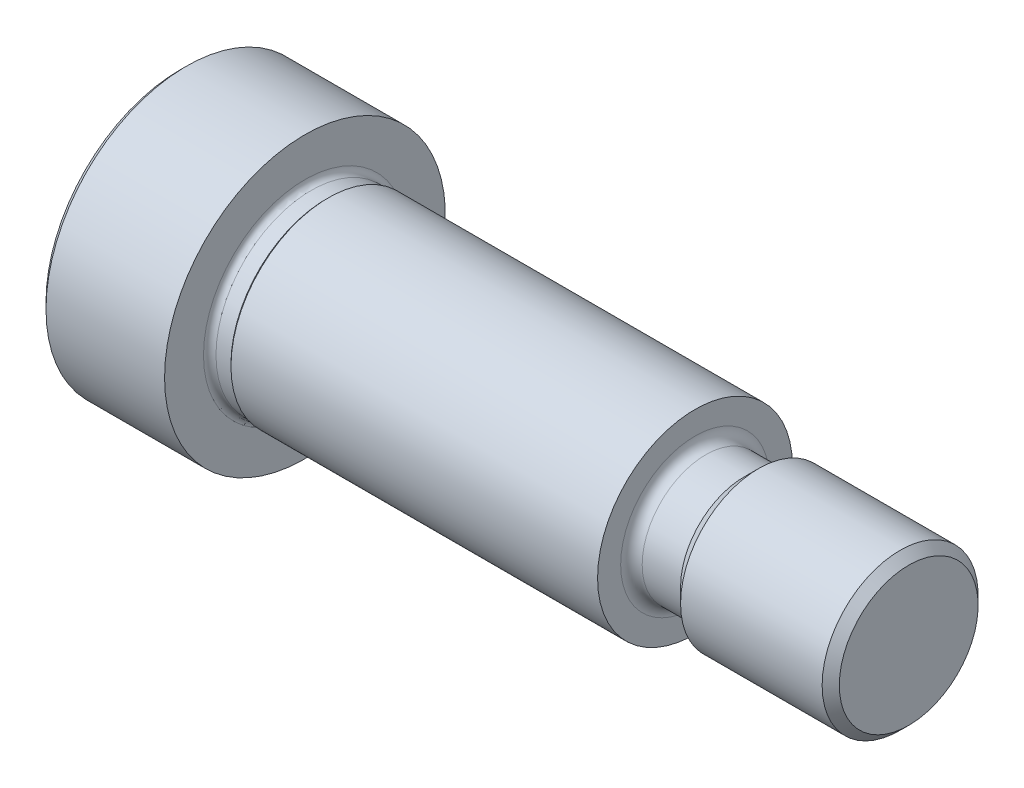
from build123d import *

# Parameters (mm, degrees)
CHAMFER1_SIZE = 0.8
HEX_2_DEPTH   = 10


with BuildPart() as part:
    # BodySke → BaseBody (revolve)
    with BuildSketch(Plane.XY):
        with BuildLine():
            Line((0, 0), (0, 18))
            Line((0, 18), (16, 18))
            Line((16, 18), (16, 13.01))
            ThreePointArc((16, 13.01), (16.234314575, 12.444314575), (16.8, 12.21))
            Line((16.8, 12.21), (18.72, 12.21))
            Line((18.72, 12.21), (19, 12.49))
            Line((19, 12.49), (66, 12.49))
            Line((66, 12.49), (66, 9.53))
            ThreePointArc((66, 9.53), (66.404192642, 8.554192642), (67.38, 8.15))
            Line((67.38, 8.15), (72.3, 8.15))
            Line((72.3, 8.15), (74.15, 10))
            Line((74.15, 10), (92.2985, 10))
            Line((92.2985, 10), (93.4, 8.8985))
            Line((93.4, 8.8985), (93.4, 0))
            Line((93.4, 0), (0, 0))
        make_face()
    revolve(axis=Axis((-6.35, 0, 0), (1, 0, 0)))

    # Chamfer1
    chamfer1_edges = [part.edges().sort_by_distance(p)[0] for p in [
        (0, -18, 0),
    ]]
    chamfer(chamfer1_edges, length=CHAMFER1_SIZE)

    # Sketch2 → PreBroach (revolve, cut)
    with BuildSketch(Plane.XY):
        Polygon((0, 6), (10, 6), (13.464101615, 0), (0, 0), align=None)
    revolve(axis=Axis((0, 0, 0), (1, 0, 0)), mode=Mode.SUBTRACT)

    # Sketch3 → Hex 2 (cut)
    with BuildSketch(Plane.ZY):
        Polygon((-6, -3.464101615), (-6, 3.464101615), (0, 6.92820323), (6, 3.464101615), (6, -3.464101615), (0, -6.92820323), align=None)
    extrude(amount=-HEX_2_DEPTH, mode=Mode.SUBTRACT)


solid = part.part
